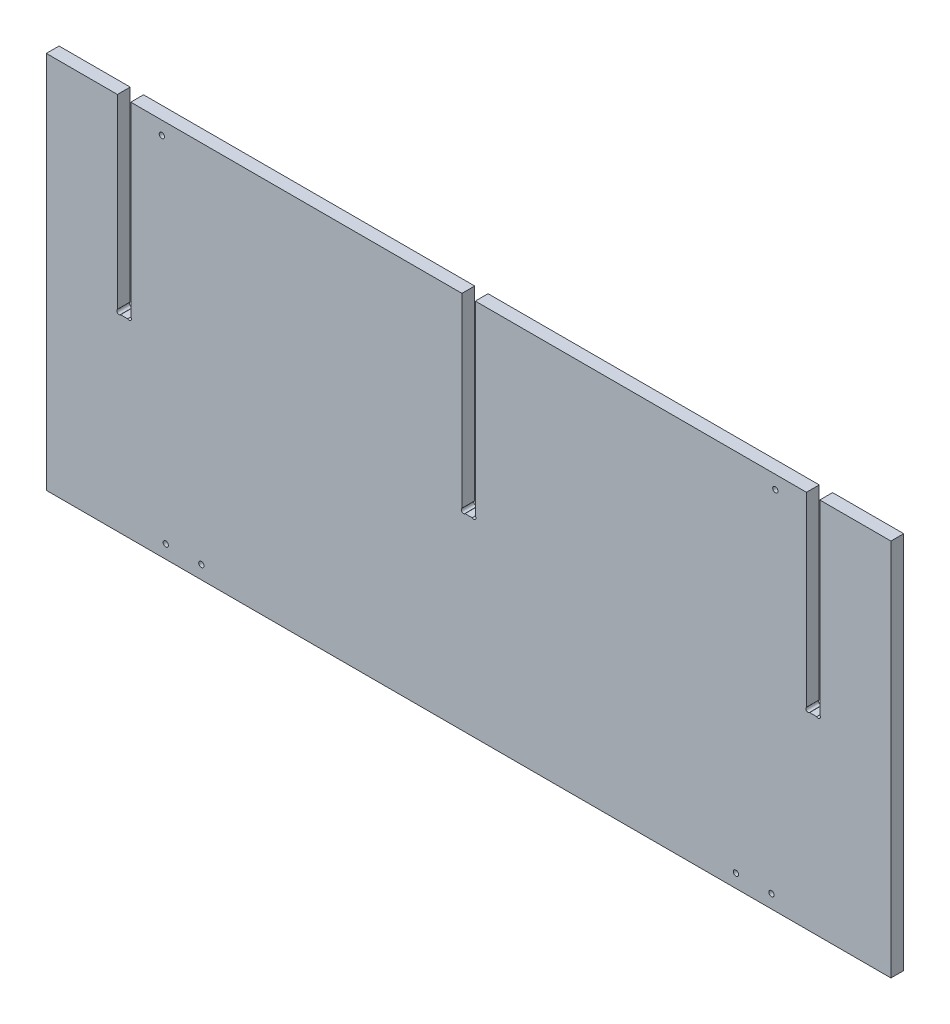
from build123d import *

# Parameters (mm, degrees)
BOSS_EXTRUDE1_DEPTH              = 18.25625
F_19_64_0_29688_DIAMETER_HOLE1_D = 7.540752


with BuildPart() as part:
    # Sketch1 → Boss-Extrude1 (new body)
    with BuildSketch(Plane.XY):
        with BuildLine():
            Line((-684.400847458, 298.45), (-582.800847458, 298.45))
            Line((-582.800847458, 298.45), (-582.800847458, 32.684128061))
            ThreePointArc((-582.800847458, 32.684128061), (-582.800847458, 28.194), (-578.310719397, 28.194))
            Line((-578.310719397, 28.194), (-568.240975518, 28.194))
            ThreePointArc((-568.240975518, 28.194), (-563.769091994, 28.212243924), (-563.750847458, 32.683978581))
            Line((-563.750847458, 32.683978581), (-563.750847458, 298.45))
            Line((-563.750847458, 298.45), (-122.425847458, 298.45))
            Line((-122.425847458, 298.45), (-90.675847458, 298.45))
            Line((-90.675847458, 298.45), (-90.675847458, 32.684128061))
            ThreePointArc((-90.675847458, 32.684128061), (-90.675847458, 28.194), (-86.185719397, 28.194))
            Line((-86.185719397, 28.194), (-76.115975518, 28.194))
            ThreePointArc((-76.115975518, 28.194), (-71.625847458, 28.194), (-71.625847458, 32.684128061))
            Line((-71.625847458, 32.684128061), (-71.625847458, 298.45))
            Line((-71.625847458, 298.45), (-44.279380116, 298.45))
            Line((-44.279380116, 298.45), (401.449152542, 298.45))
            Line((401.449152542, 298.45), (401.449152542, 32.577935832))
            ThreePointArc((401.449152542, 32.577935832), (401.50829589, 28.134856653), (405.951375069, 28.194))
            Line((405.951375069, 28.194), (416.009024482, 28.194))
            ThreePointArc((416.009024482, 28.194), (420.499152542, 28.194), (420.499152542, 32.684128061))
            Line((420.499152542, 32.684128061), (420.499152542, 298.45))
            Line((420.499152542, 298.45), (522.099152542, 298.45))
            Line((522.099152542, 298.45), (522.099152542, -242.09375))
            Line((522.099152542, -242.09375), (-684.400847458, -242.09375))
            Line((-684.400847458, -242.09375), (-684.400847458, 298.45))
        make_face()
    extrude(amount=BOSS_EXTRUDE1_DEPTH)

    # 19/64 (0.29688) Diameter Hole1 (through all)
    with Locations(Plane(origin=(0, 0, 0), x_dir=(-1, 0, 0), z_dir=(0, 0, -1))):
        with Locations((-351.442902542, -223.04375), (-300.642902542, -223.04375), (-356.999152542, 279.38402607), (519.300847458, 279.4), (513.744597458, -223.04375), (462.944597458, -223.04375)):
            Hole(F_19_64_0_29688_DIAMETER_HOLE1_D / 2)


solid = part.part
